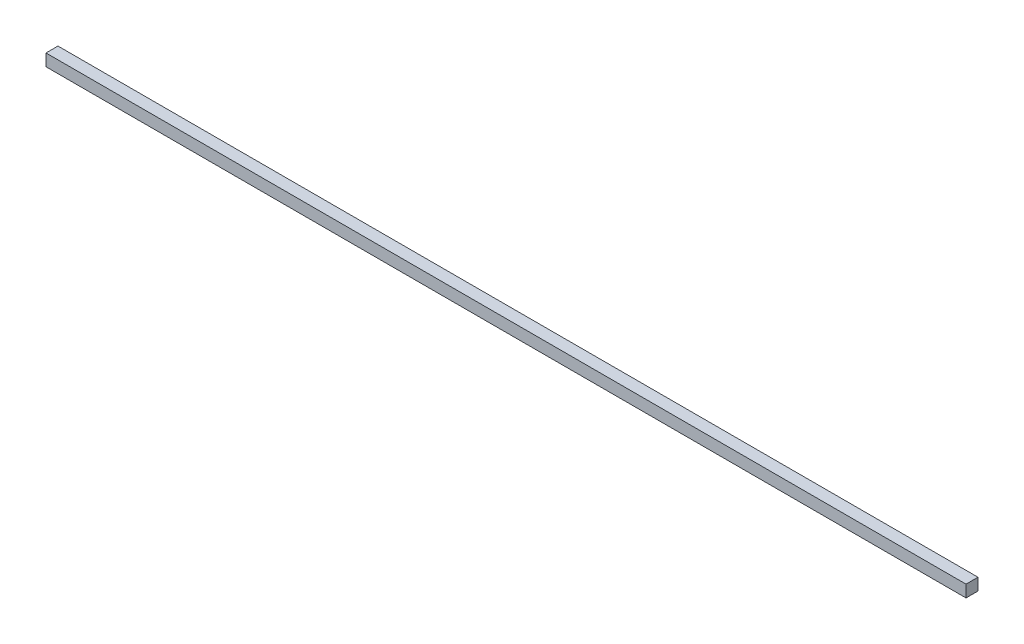
from build123d import *

# Parameters (mm, degrees)
SKETCH_1_W      = 384
SKETCH_1_H      = 5
EXTRUDE_1_DEPTH = 5


with BuildPart() as part:
    # ｽｹｯﾁ1 → ﾎﾞｽ - 押し出し1 (new body)
    with BuildSketch(Plane.XY):
        with Locations((109.848439705, 7.478571429)):
            Rectangle(SKETCH_1_W, SKETCH_1_H)
    extrude(amount=EXTRUDE_1_DEPTH)


solid = part.part
